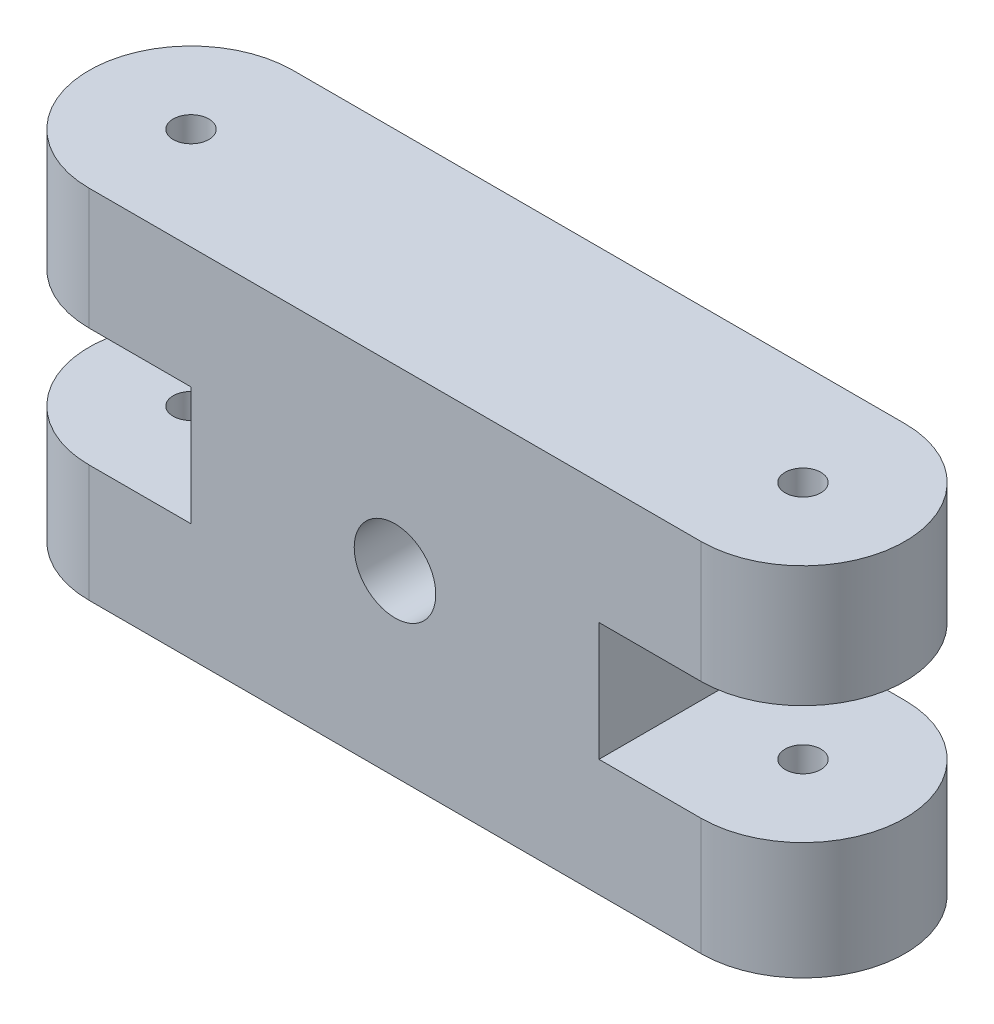
from build123d import *

# Parameters (mm, degrees)
SKETCH1_R           = 1.75
BOSS_EXTRUDE1_DEPTH = 35
SKETCH3_W           = 24.518111011
SKETCH3_H           = 11.618606297
SKETCH3_R           = 4
CUT_EXTRUDE1_DEPTH  = 20


with BuildPart() as part:
    # Sketch1 → Boss-Extrude1 (new body)
    with BuildSketch(Plane(origin=(0, 0, 0), x_dir=(1, 0, 0), z_dir=(0, 1, 0))):
        with BuildLine():
            Line((30, 10), (-30, 10))
            ThreePointArc((-30, 10), (-40, 0), (-30, -10))
            Line((-30, -10), (30, -10))
            ThreePointArc((30, -10), (40, 0), (30, 10))
        make_face()
        with Locations((-30, 0)):
            Circle(SKETCH1_R, mode=Mode.SUBTRACT)
        with Locations((30, 0)):
            Circle(SKETCH1_R, mode=Mode.SUBTRACT)
    extrude(amount=BOSS_EXTRUDE1_DEPTH)

    # Sketch3 → Cut-Extrude1 (cut)
    with BuildSketch(Plane(origin=(0, 0, -10), x_dir=(-1, 0, 0), z_dir=(0, 0, -1))):
        with Locations((32.259055506, 17.309303148)):
            Rectangle(SKETCH3_W, SKETCH3_H)
        with Locations((-32.259055506, 17.309303148)):
            Rectangle(SKETCH3_W, SKETCH3_H)
        with Locations((0, 17.5)):
            Circle(SKETCH3_R)
    extrude(amount=-CUT_EXTRUDE1_DEPTH, mode=Mode.SUBTRACT)


solid = part.part
